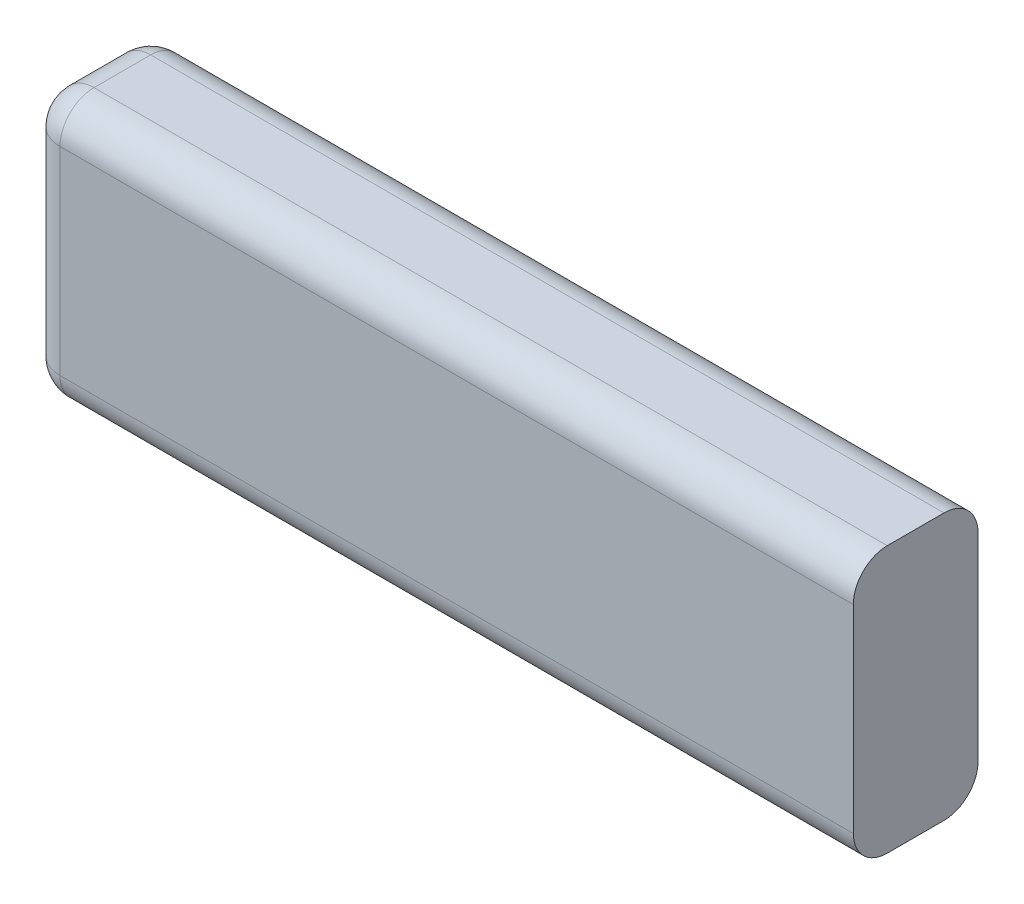
from build123d import *

# Parameters (mm, degrees)
SKETCH1_W           = 36.5
SKETCH1_H           = 11.75
BOSS_EXTRUDE1_DEPTH = 5.5
FILLET1_R           = 1.5


with BuildPart() as part:
    # Sketch1 → Boss-Extrude1 (new body)
    with BuildSketch(Plane.XY):
        with Locations((18.25, 5.875)):
            Rectangle(SKETCH1_W, SKETCH1_H)
    extrude(amount=BOSS_EXTRUDE1_DEPTH)

    # Fillet1
    fillet1_edges = [part.edges().sort_by_distance(p)[0] for p in [
        (18.25, 0, 0),
        (18.25, 0, 5.5),
        (0, 0, 2.75),
        (0, 5.875, 0),
        (0, 5.875, 5.5),
        (18.25, 11.75, 0),
        (18.25, 11.75, 5.5),
        (0, 11.75, 2.75),
    ]]
    fillet(fillet1_edges, radius=FILLET1_R)


solid = part.part
